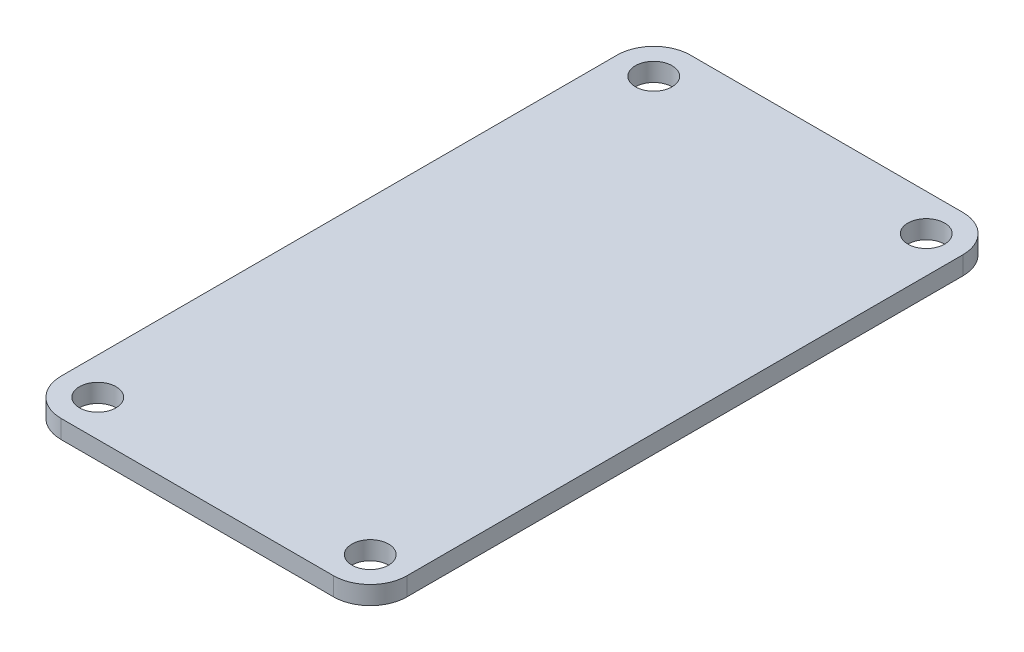
from build123d import *

# Parameters (mm, degrees)
BOSS_EXTRUDE1_DEPTH = 0.75
CUT_EXTRUDE1_REACH  = 31.42
SKETCH3_R           = 1.5


with BuildPart() as part:
    # Sketch1 → Boss-Extrude1 (new, symmetric)
    with BuildSketch(Plane(origin=(0, 0, 0), x_dir=(1, 0, 0), z_dir=(0, 1, 0))):
        with BuildLine():
            Line((-11.15, 25.75), (11.15, 25.75))
            ThreePointArc((11.15, 25.75), (13.271320344, 24.871320344), (14.15, 22.75))
            Line((14.15, 22.75), (14.15, -22.75))
            ThreePointArc((14.15, -22.75), (13.271320344, -24.871320344), (11.15, -25.75))
            Line((11.15, -25.75), (-11.15, -25.75))
            ThreePointArc((-11.15, -25.75), (-13.271320344, -24.871320344), (-14.15, -22.75))
            Line((-14.15, -22.75), (-14.15, 22.75))
            ThreePointArc((-14.15, 22.75), (-13.271320344, 24.871320344), (-11.15, 25.75))
        make_face()
    extrude(amount=BOSS_EXTRUDE1_DEPTH, both=True)

    # Sketch3 → Cut-Extrude1 (cut, up to next)
    with BuildSketch(Plane(origin=(0, 0.75, 0), x_dir=(1, 0, 0), z_dir=(0, 1, 0)), mode=Mode.PRIVATE) as cut_extrude1_sk1:
        with Locations((-11.15, -22.75)):
            Circle(SKETCH3_R)
    cut_extrude1_tool1 = extrude(cut_extrude1_sk1.sketch, amount=-CUT_EXTRUDE1_REACH, mode=Mode.PRIVATE) & part.part
    # Sketch3 → Cut-Extrude1 (cut, up to next)
    with BuildSketch(Plane(origin=(0, 0.75, 0), x_dir=(1, 0, 0), z_dir=(0, 1, 0)), mode=Mode.PRIVATE) as cut_extrude1_sk2:
        with Locations((-11.15, 22.75)):
            Circle(SKETCH3_R)
    cut_extrude1_tool2 = extrude(cut_extrude1_sk2.sketch, amount=-CUT_EXTRUDE1_REACH, mode=Mode.PRIVATE) & part.part
    # Sketch3 → Cut-Extrude1 (cut, up to next)
    with BuildSketch(Plane(origin=(0, 0.75, 0), x_dir=(1, 0, 0), z_dir=(0, 1, 0)), mode=Mode.PRIVATE) as cut_extrude1_sk3:
        with Locations((11.15, -22.75)):
            Circle(SKETCH3_R)
    cut_extrude1_tool3 = extrude(cut_extrude1_sk3.sketch, amount=-CUT_EXTRUDE1_REACH, mode=Mode.PRIVATE) & part.part
    # Sketch3 → Cut-Extrude1 (cut, up to next)
    with BuildSketch(Plane(origin=(0, 0.75, 0), x_dir=(1, 0, 0), z_dir=(0, 1, 0)), mode=Mode.PRIVATE) as cut_extrude1_sk4:
        with Locations((11.15, 22.75)):
            Circle(SKETCH3_R)
    cut_extrude1_tool4 = extrude(cut_extrude1_sk4.sketch, amount=-CUT_EXTRUDE1_REACH, mode=Mode.PRIVATE) & part.part
    add(cut_extrude1_tool1.solids().sort_by_distance((-11.15, 0.75, 22.75))[0], mode=Mode.SUBTRACT)
    add(cut_extrude1_tool2.solids().sort_by_distance((-11.15, 0.75, -22.75))[0], mode=Mode.SUBTRACT)
    add(cut_extrude1_tool3.solids().sort_by_distance((11.15, 0.75, 22.75))[0], mode=Mode.SUBTRACT)
    add(cut_extrude1_tool4.solids().sort_by_distance((11.15, 0.75, -22.75))[0], mode=Mode.SUBTRACT)


solid = part.part
